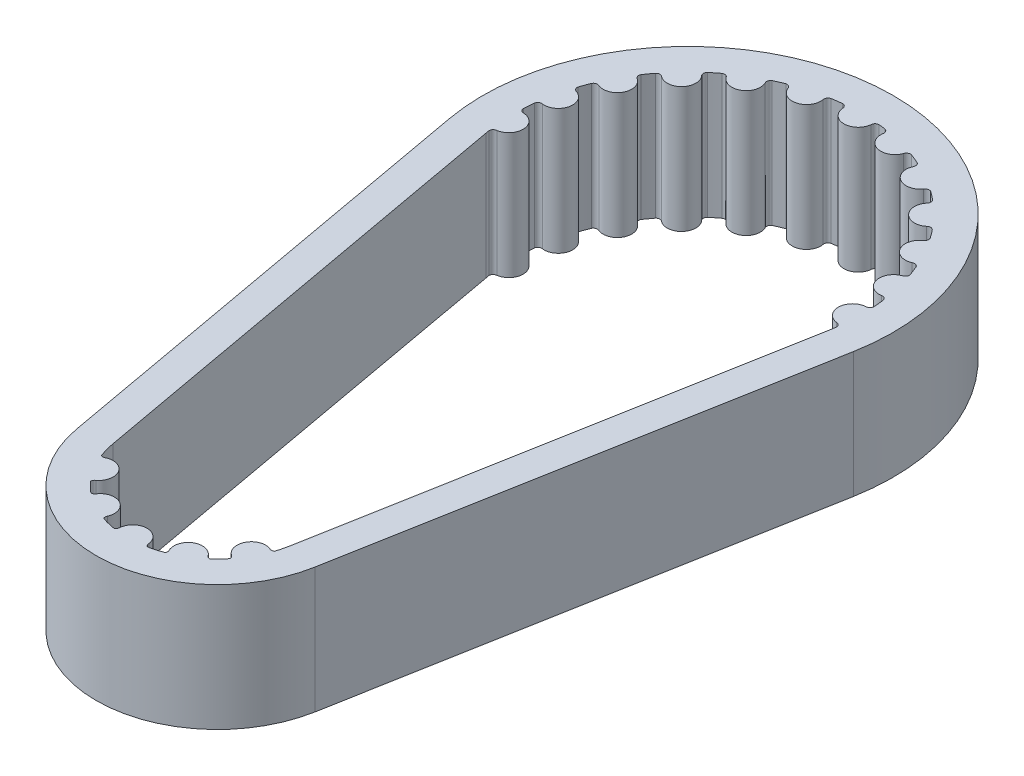
from build123d import *

# Parameters (mm, degrees)
BOSS_EXTRUDE1_DEPTH = 8
BOSS_EXTRUDE3_DEPTH = 8
CRVPATTERN1_DEPTH   = 8


# Read off the part's stored shape, not the designer's step: CrvPattern1
with BuildPart() as part:
    # Sketch1 → Boss-Extrude1 (new body)
    with BuildSketch(Plane(origin=(0, 0, 0), x_dir=(1, 0, 0), z_dir=(0, 1, 0))):
        with BuildLine():
            Line((-7.606089126, -31.378516667), (-12.870329337, -2.3326))
            ThreePointArc((-12.870329337, -2.3326), (0, 13.08), (12.870329337, -2.3326))
            Line((12.870329337, -2.3326), (7.606089126, -31.378516667))
            ThreePointArc((7.606089126, -31.378516667), (0, -37.73), (-7.606089126, -31.378516667))
        make_face()
        with BuildLine():
            ThreePointArc((-5.638148861, -31.02185), (0, -35.73), (5.638148861, -31.02185))
            Line((5.638148861, -31.02185), (10.902389071, -1.975933333))
            ThreePointArc((10.902389071, -1.975933333), (0, 11.08), (-10.902389071, -1.975933333))
            Line((-10.902389071, -1.975933333), (-5.638148861, -31.02185))
        make_face(mode=Mode.SUBTRACT)
    extrude(amount=BOSS_EXTRUDE1_DEPTH)

    # Sketch2 → Boss-Extrude3 (add)
    with BuildSketch(Plane(origin=(0, 0, 0), x_dir=(1, 0, 0), z_dir=(0, 1, 0))):
        with BuildLine():
            ThreePointArc((-1.165, 11.018583167), (-0.981152237, 10.94243093), (-0.905, 10.758583167))
            ThreePointArc((-0.905, 10.758583167), (0, 9.943845961), (0.905, 10.758583167))
            ThreePointArc((0.905, 10.758583167), (0.981152237, 10.94243093), (1.165, 11.018583167))
            ThreePointArc((1.165, 11.018583167), (0, 11.08), (-1.165, 11.018583167))
        make_face()
    extrude(amount=BOSS_EXTRUDE3_DEPTH)

    # CrvPattern1 outline → CrvPattern1 (add)
    with BuildSketch(Plane(origin=(0, 0, 0), x_dir=(1, 0, 0), z_dir=(0, 1, 0))):
        with BuildLine():
            ThreePointArc((-1.824495283, 10.928751849), (-2.963479144, 10.676337919), (-4.069609665, 10.30556535))
            ThreePointArc((-4.069609665, 10.30556535), (-3.872091938, 10.281359754), (-3.749541755, 10.124577689))
            ThreePointArc((-3.749541755, 10.124577689), (-2.659601093, 9.581575785), (-2.005482944, 10.608683939))
            ThreePointArc((-2.005482944, 10.608683939), (-1.981277348, 10.806201665), (-1.824495283, 10.928751849))
        make_face()
        with BuildLine():
            ThreePointArc((-10.791666914, 0.325671569), (-10.979340539, 0.391836316), (-11.06526029, 0.57132715))
            ThreePointArc((-11.06526029, 0.57132715), (-11.063997012, -0.595289939), (-10.940077478, -1.755307601))
            ThreePointArc((-10.940077478, -1.755307601), (-10.873912731, -1.567633976), (-10.694421897, -1.481714224))
            ThreePointArc((-10.694421897, -1.481714224), (-9.929483935, -0.534248326), (-10.791666914, 0.325671569))
        make_face()
        with BuildLine():
            ThreePointArc((-10.311404493, 3.200167829), (-10.474544311, 3.314117655), (-10.509326889, 3.510049622))
            ThreePointArc((-10.509326889, 3.510049622), (-10.820135393, 2.385596376), (-11.010991108, 1.23469624))
            ThreePointArc((-11.010991108, 1.23469624), (-10.897041283, 1.397836059), (-10.701109316, 1.432618636))
            ThreePointArc((-10.701109316, 1.432618636), (-9.710628125, 2.14097499), (-10.311404493, 3.200167829))
        make_face()
        with BuildLine():
            ThreePointArc((-9.079820232, 5.841489648), (-9.206539356, 5.994921805), (-9.18765039, 6.193018676))
            ThreePointArc((-9.18765039, 6.193018676), (-9.787884177, 5.192660526), (-10.279608785, 4.134736173))
            ThreePointArc((-10.279608785, 4.134736173), (-10.126176628, 4.261455297), (-9.928079758, 4.242566331))
            ThreePointArc((-9.928079758, 4.242566331), (-8.784224959, 4.660200036), (-9.079820232, 5.841489648))
        make_face()
        with BuildLine():
            ThreePointArc((-7.18665129, 8.057181889), (-7.267716561, 8.23891682), (-7.196532361, 8.424744624))
            ThreePointArc((-7.196532361, 8.424744624), (-8.042456481, 7.621370857), (-8.799221359, 6.733506032))
            ThreePointArc((-8.799221359, 6.733506032), (-8.617486428, 6.814571302), (-8.431658623, 6.743387102))
            ThreePointArc((-8.431658623, 6.743387102), (-7.217775126, 6.839868035), (-7.18665129, 8.057181889))
        make_face()
        with BuildLine():
            ThreePointArc((-4.76984, 9.685802142), (-4.799344742, 9.88259806), (-4.681052017, 10.042616791))
            ThreePointArc((-4.681052017, 10.042616791), (-5.71102974, 9.494763784), (-6.677694581, 8.841651151))
            ThreePointArc((-6.677694581, 8.841651151), (-6.480898663, 8.871155893), (-6.320879932, 8.752863168))
            ThreePointArc((-6.320879932, 8.752863168), (-5.125415163, 8.521161417), (-4.76984, 9.685802142))
        make_face()
        with BuildLine():
            ThreePointArc((-5.358787187, -32.02886665), (-4.902775765, -32.965752822), (-4.284641775, -33.804568945))
            ThreePointArc((-4.284641775, -33.804568945), (-4.253283685, -33.672171144), (-4.159348022, -33.573740464))
            ThreePointArc((-4.159348022, -33.573740464), (-3.930645139, -32.377698364), (-5.096173957, -32.025045153))
            ThreePointArc((-5.096173957, -32.025045153), (-5.226962568, -32.062553109), (-5.358787187, -32.02886665))
        make_face()
        with BuildLine():
            ThreePointArc((4.301302835, -33.401557112), (4.399165403, -33.496084492), (4.435884173, -33.627096856))
            ThreePointArc((4.435884173, -33.627096856), (5.019378866, -32.763826296), (5.436895219, -31.809162894))
            ThreePointArc((5.436895219, -31.809162894), (5.306550294, -31.848184784), (5.174343952, -31.816029058))
            ThreePointArc((5.174343952, -31.816029058), (4.024127982, -32.215810168), (4.301302835, -33.401557112))
        make_face()
        with BuildLine():
            ThreePointArc((2.024455519, -35.096408218), (2.061948343, -35.227201168), (2.028246633, -35.359021888))
            ThreePointArc((2.028246633, -35.359021888), (2.965185558, -34.903118865), (3.804073193, -34.28508193))
            ThreePointArc((3.804073193, -34.28508193), (3.671679021, -34.253708522), (3.57325921, -34.159761471))
            ThreePointArc((3.57325921, -34.159761471), (2.377243578, -33.930920208), (2.024455519, -35.096408218))
        make_face()
        with BuildLine():
            ThreePointArc((-0.794764946, -35.425877399), (-0.827686591, -35.557895098), (-0.922779735, -35.655208003))
            ThreePointArc((-0.922779735, -35.655208003), (0.116587527, -35.728813782), (1.15209953, -35.612981977))
            ThreePointArc((1.15209953, -35.612981977), (1.053125917, -35.519618539), (1.01486035, -35.389049577))
            ThreePointArc((1.01486035, -35.389049577), (0.093470356, -34.592894948), (-0.794764946, -35.425877399))
        make_face()
        with BuildLine():
            ThreePointArc((-3.401059435, -34.301696362), (-3.495575491, -34.399569865), (-3.626583606, -34.436303793))
            ThreePointArc((-3.626583606, -34.436303793), (-2.763245543, -35.019698603), (-1.808533841, -35.4371045))
            ThreePointArc((-1.808533841, -35.4371045), (-1.847570812, -35.30676409), (-1.815430382, -35.174554029))
            ThreePointArc((-1.815430382, -35.174554029), (-2.215344568, -34.02438432), (-3.401059435, -34.301696362))
        make_face()
        with BuildLine():
            ThreePointArc((10.974594379, -1.524689547), (11.074074387, -0.36232095), (11.05078642, 0.804064363))
            ThreePointArc((11.05078642, 0.804064363), (10.968663006, 0.622805134), (10.782423353, 0.552705528))
            ThreePointArc((10.782423353, 0.552705528), (9.938527966, -0.325168205), (10.723235544, -1.25632648))
            ThreePointArc((10.723235544, -1.25632648), (10.904494773, -1.338449894), (10.974594379, -1.524689547))
        make_face()
        with BuildLine():
            ThreePointArc((3.535643905, 10.201243009), (3.654867535, 10.36056937), (3.851832122, 10.388926282))
            ThreePointArc((3.851832122, 10.388926282), (2.738143815, 10.73633869), (1.59410025, 10.964727283))
            ThreePointArc((1.59410025, 10.964727283), (1.753426611, 10.845503653), (1.781783523, 10.648539065))
            ThreePointArc((1.781783523, 10.648539065), (2.457371869, 9.635424017), (3.535643905, 10.201243009))
        make_face()
        with BuildLine():
            ThreePointArc((6.135279783, 8.883944999), (6.292773656, 9.005579053), (6.490146906, 8.980222333))
            ThreePointArc((6.490146906, 8.980222333), (5.509951663, 9.612847272), (4.468672705, 10.138903504))
            ThreePointArc((4.468672705, 10.138903504), (4.590306759, 9.981409631), (4.564950039, 9.784036381))
            ThreePointArc((4.564950039, 9.784036381), (4.944955829, 8.627136509), (6.135279783, 8.883944999))
        make_face()
        with BuildLine():
            ThreePointArc((8.287879594, 6.919334403), (8.472168203, 6.994413506), (8.655568872, 6.917190724))
            ThreePointArc((8.655568872, 6.917190724), (7.880286848, 7.788933123), (7.017643405, 8.574326857))
            ThreePointArc((7.017643405, 8.574326857), (7.092722508, 8.390038247), (7.015499725, 8.206637579))
            ThreePointArc((7.015499725, 8.206637579), (7.072234526, 6.990248301), (8.287879594, 6.919334403))
        make_face()
        with BuildLine():
            ThreePointArc((9.836598048, 4.450559019), (10.034253538, 4.473612668), (10.190318466, 4.350150522))
            ThreePointArc((10.190318466, 4.350150522), (9.676439183, 5.397492448), (9.055286209, 6.38499739))
            ThreePointArc((9.055286209, 6.38499739), (9.078339857, 6.187341901), (8.954877712, 6.031276973))
            ThreePointArc((8.954877712, 6.031276973), (8.684207644, 4.844028293), (9.836598048, 4.450559019))
        make_face()
        with BuildLine():
            ThreePointArc((10.668590575, 1.657501702), (10.865211135, 1.626850133), (10.982568934, 1.46614447))
            ThreePointArc((10.982568934, 1.46614447), (10.767535277, 2.612773248), (10.43313196, 3.730436636))
            ThreePointArc((10.43313196, 3.730436636), (10.402480392, 3.533816076), (10.241774729, 3.416458277))
            ThreePointArc((10.241774729, 3.416458277), (9.663421677, 2.344856923), (10.668590575, 1.657501702))
        make_face()
    extrude(amount=CRVPATTERN1_DEPTH)


solid = part.part
